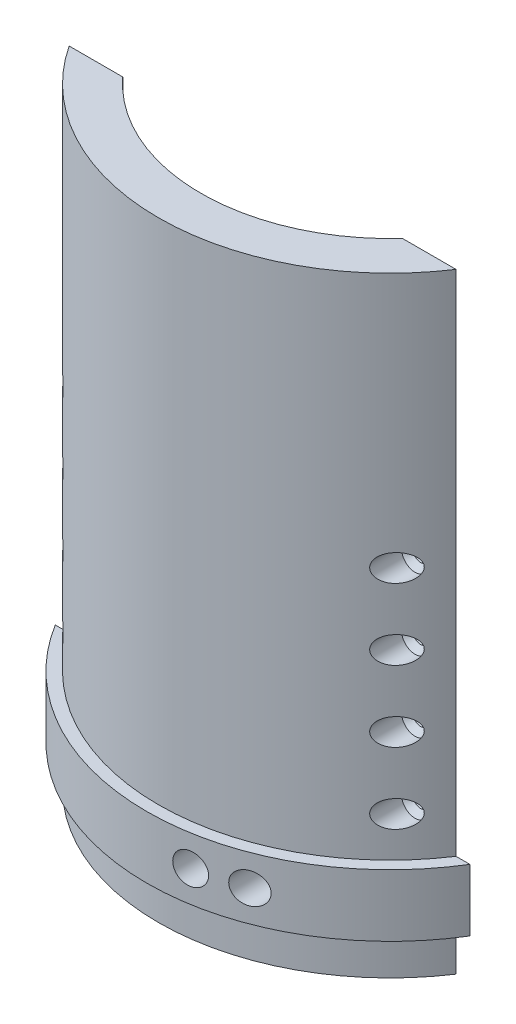
from build123d import *

# Parameters (mm, degrees)
BOSS_EXTRUDE1_DEPTH      = 92.46
LPATTERN1_COUNT          = 5
LPATTERN1_PITCH          = 15.41
BOSS_EXTRUDE2_DEPTH      = 6.731
BOSS_EXTRUDE2_DEPTH_BACK = 6.731
SKETCH9_R                = 3.334469726
CUT_EXTRUDE1_DEPTH       = 34
BOSS_EXTRUDE3_DEPTH      = 40


with BuildPart() as part:
    # Sketch1 → Boss-Extrude1 (new body)
    with BuildSketch(Plane(origin=(60.535204745, 0, -85.948449604), x_dir=(1, 0, 0), z_dir=(0, 1, 0))):
        with BuildLine():
            ThreePointArc((-30.186446753, -113.644462538), (-60.535204745, -127.035141416), (-90.883962736, -113.644462538))
            Line((-90.883962736, -113.644462538), (-102.513962844, -113.644462538))
            ThreePointArc((-102.513962844, -113.644462538), (-60.535204745, -136.240449604), (-18.556446645, -113.644462538))
            Line((-18.556446645, -113.644462538), (-30.186446753, -113.644462538))
        make_face()
    extrude(amount=BOSS_EXTRUDE1_DEPTH)

    # Sketch6 → Cut-Revolve4 (revolve, cut)
    with BuildSketch(Plane(origin=(36.163758045, 15.41, 27.696012934), x_dir=(-1, 0, 0), z_dir=(0, -1, 0))):
        Polygon((0, 1.685394277), (0, -4.78184701), (0, -15.185924704), (-2.9, -15.185924704), (-2.9, -3.079025683), (-1.65, -1.881964943), (-1.65, 1.685394277), align=None)
    cut_revolve4 = revolve(axis=Axis((36.163758045, 15.41, 26.010618657), (0, 0, 1)), mode=Mode.SUBTRACT)

    # LPattern1: Cut-Revolve4 ×5
    with Locations(*[(0, i * LPATTERN1_PITCH, 0) for i in range(1, LPATTERN1_COUNT)]):
        add(cut_revolve4, mode=Mode.SUBTRACT)

    # Mirror1: Cut-Revolve4 across plane
    add(cut_revolve4.mirror(Plane(origin=(0, 0, 0), x_dir=(0, 0, 1), z_dir=(1, 0, 0))), mode=Mode.SUBTRACT)

    # Mirror1 copy 1 sketch → Mirror1 copy 1 (revolve, cut)
    with BuildSketch(Plane(origin=(-36.163758045, 30.82, 27.696012934), x_dir=(1, 0, 0), z_dir=(0, -1, 0))):
        Polygon((0, -1.685394277), (0, 4.78184701), (0, 15.185924704), (-2.9, 15.185924704), (-2.9, 3.079025683), (-1.65, 1.881964943), (-1.65, -1.685394277), align=None)
    revolve(axis=Axis((-36.163758045, 30.82, 26.010618657), (0, 0, -1)), mode=Mode.SUBTRACT)

    # Mirror1 copy 2 sketch → Mirror1 copy 2 (revolve, cut)
    with BuildSketch(Plane(origin=(-36.163758045, 46.23, 27.696012934), x_dir=(1, 0, 0), z_dir=(0, -1, 0))):
        Polygon((0, -1.685394277), (0, 4.78184701), (0, 15.185924704), (-2.9, 15.185924704), (-2.9, 3.079025683), (-1.65, 1.881964943), (-1.65, -1.685394277), align=None)
    revolve(axis=Axis((-36.163758045, 46.23, 26.010618657), (0, 0, -1)), mode=Mode.SUBTRACT)

    # Mirror1 copy 3 sketch → Mirror1 copy 3 (revolve, cut)
    with BuildSketch(Plane(origin=(-36.163758045, 61.64, 27.696012934), x_dir=(1, 0, 0), z_dir=(0, -1, 0))):
        Polygon((0, -1.685394277), (0, 4.78184701), (0, 15.185924704), (-2.9, 15.185924704), (-2.9, 3.079025683), (-1.65, 1.881964943), (-1.65, -1.685394277), align=None)
    revolve(axis=Axis((-36.163758045, 61.64, 26.010618657), (0, 0, -1)), mode=Mode.SUBTRACT)

    # Mirror1 copy 4 sketch → Mirror1 copy 4 (revolve, cut)
    with BuildSketch(Plane(origin=(-36.163758045, 77.05, 27.696012934), x_dir=(1, 0, 0), z_dir=(0, -1, 0))):
        Polygon((0, -1.685394277), (0, 4.78184701), (0, 15.185924704), (-2.9, 15.185924704), (-2.9, 3.079025683), (-1.65, 1.881964943), (-1.65, -1.685394277), align=None)
    revolve(axis=Axis((-36.163758045, 77.05, 26.010618657), (0, 0, -1)), mode=Mode.SUBTRACT)

    # Sketch7 → Boss-Extrude2 (add, two sides: drawn at the far end of the back side and taken through both)
    with BuildSketch(Plane(origin=(0, 15.41, 0), x_dir=(-1, 0, 0), z_dir=(0, -1, 0)).offset(-BOSS_EXTRUDE2_DEPTH_BACK)):
        with BuildLine():
            Line((-44.990566695, -27.696012934), (-41.978758099, -27.696012934))
            ThreePointArc((-41.978758099, -27.696012934), (0, -50.292), (41.978758099, -27.696012934))
            Line((41.978758099, -27.696012934), (44.990566695, -27.696012934))
            ThreePointArc((44.990566695, -27.696012934), (0, -52.832), (-44.990566695, -27.696012934))
        make_face()
    extrude(amount=BOSS_EXTRUDE2_DEPTH + BOSS_EXTRUDE2_DEPTH_BACK)

    # Sketch9 → Cut-Extrude1 (cut)
    with BuildSketch(Plane(origin=(0, 0, 27.696012934), x_dir=(-1, 0, 0), z_dir=(0, 0, -1))):
        with Locations((-18.801989508, 15.41)):
            Circle(SKETCH9_R)
        with Locations((-8.69556827, 15.41)):
            Circle(SKETCH9_R)
    extrude(amount=-CUT_EXTRUDE1_DEPTH, mode=Mode.SUBTRACT)

    # Sketch10 → Boss-Extrude3 (add)
    with BuildSketch(Plane(origin=(0, 92.46, 0), x_dir=(1, 0, 0), z_dir=(0, 1, 0))):
        with BuildLine():
            Line((-30.348757991, -27.696012934), (-41.978758099, -27.696012934))
            ThreePointArc((-41.978758099, -27.696012934), (0, -50.292), (41.978758099, -27.696012934))
            Line((41.978758099, -27.696012934), (30.348757991, -27.696012934))
            ThreePointArc((30.348757991, -27.696012934), (0, -41.086691812), (-30.348757991, -27.696012934))
        make_face()
    extrude(amount=BOSS_EXTRUDE3_DEPTH)


solid = part.part
